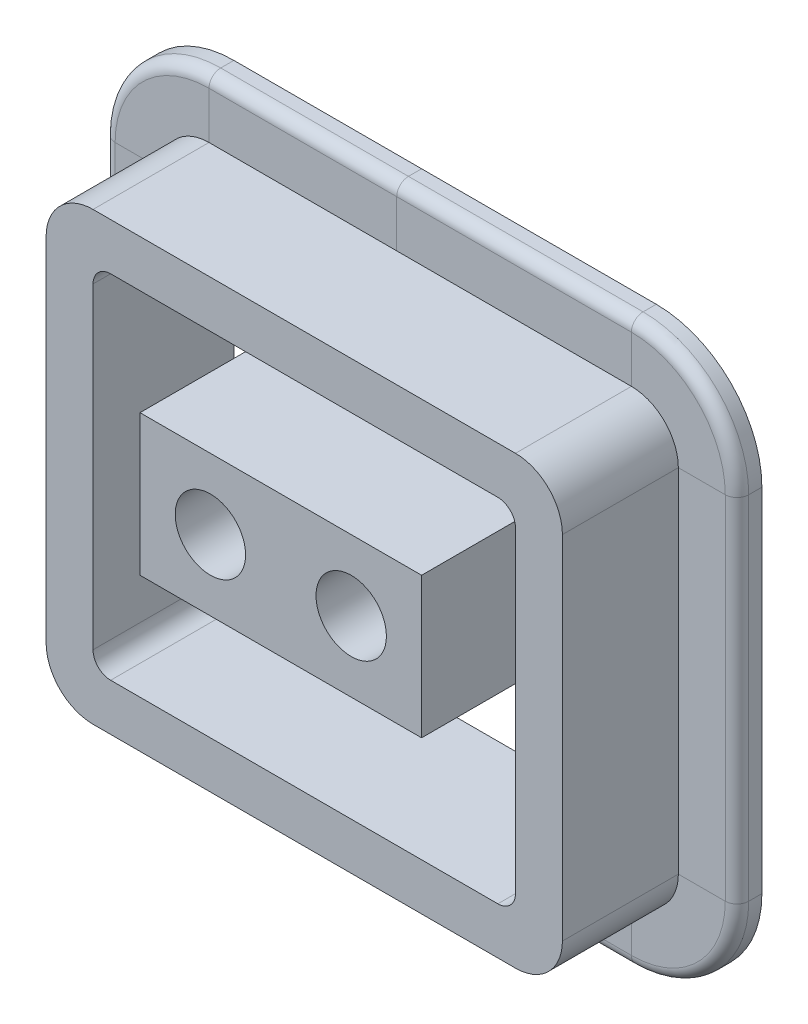
from build123d import *

# Parameters (mm, degrees)
SKETCH1_W           = 12
SKETCH1_H           = 6
SKETCH1_R           = 1.5
BOSS_EXTRUDE1_DEPTH = 3
SKETCH2_W           = 22
SKETCH2_H           = 19
SKETCH2_W_2         = 18
SKETCH2_H_2         = 15
BOSS_EXTRUDE2_DEPTH = 3
FILLET3_R           = 2
SKETCH5_W           = 1.059809024
SKETCH5_H           = 2.5
FILLET4_R           = 0.5
FILLET5_R           = 0.75


with BuildPart() as part:
    # Sketch1 → Boss-Extrude1 (new, symmetric)
    with BuildSketch(Plane.XY):
        Rectangle(SKETCH1_W, SKETCH1_H)
        with Locations((-3, 0)):
            Circle(SKETCH1_R, mode=Mode.SUBTRACT)
        with Locations((3, 0)):
            Circle(SKETCH1_R, mode=Mode.SUBTRACT)
    extrude(amount=BOSS_EXTRUDE1_DEPTH, both=True)


with BuildPart() as body_2:
    # Sketch2 → Boss-Extrude2 (new, symmetric)
    with BuildSketch(Plane.XY):
        with Locations((1, 0)):
            Rectangle(SKETCH2_W, SKETCH2_H)
        with Locations((1, 0)):
            Rectangle(SKETCH2_W_2, SKETCH2_H_2, mode=Mode.SUBTRACT)
    extrude(amount=BOSS_EXTRUDE2_DEPTH, both=True)

    # Fillet3
    fillet3_edges = [body_2.edges().sort_by_distance(p)[0] for p in [
        (12, 9.5, 0),
        (12, -9.5, 0),
        (-10, -9.5, 0),
        (-10, 9.5, 0),
    ]]
    fillet(fillet3_edges, radius=FILLET3_R)

    # Fillet5
    fillet5_edges = [body_2.edges().sort_by_distance(p)[0] for p in [
        (10, 7.5, 0),
        (10, -7.5, 0),
        (-8, -7.5, 0),
        (-8, 7.5, 0),
    ]]
    fillet(fillet5_edges, radius=FILLET5_R)


with BuildPart() as body_3:
    # Sweep1: sweep along a path in Sketch6
    with BuildLine(Plane.XY) as sweep1_path:
        Line((12, -7.5), (12, 7.5))
        ThreePointArc((12, 7.5), (11.414213562, 8.914213562), (10, 9.5))
        Line((10, 9.5), (-8, 9.5))
        ThreePointArc((-8, 9.5), (-9.414213562, 8.914213562), (-10, 7.5))
        Line((-10, 7.5), (-10, -7.5))
        ThreePointArc((-10, -7.5), (-9.414213562, -8.914213562), (-8, -9.5))
        Line((-8, -9.5), (10, -9.5))
        ThreePointArc((10, -9.5), (11.414213562, -8.914213562), (12, -7.5))
    # Sketch5 → Sweep1 (sweep)
    with BuildSketch(Plane(origin=(0, 0, 0), x_dir=(0, 0, -1), z_dir=(1, 0, 0))):
        with Locations((2.470095488, 10.75)):
            Rectangle(SKETCH5_W, SKETCH5_H)
    sweep(path=sweep1_path.line)

    # Fillet4
    fillet4_edges = [body_3.edges().sort_by_distance(p)[0] for p in [
        (1, 12, -1.940190976),
        (-11.181980515, 10.681980515, -1.940190976),
        (-12.5, 0, -1.940190976),
        (-11.181980515, -10.681980515, -1.940190976),
        (1, -12, -1.940190976),
        (13.181980515, -10.681980515, -1.940190976),
        (14.5, 0, -1.940190976),
        (13.181980515, 10.681980515, -1.940190976),
        (1, 12, -1.940190976),
    ]]
    fillet(fillet4_edges, radius=FILLET4_R)


solid = Compound([part.part, body_2.part, body_3.part])
